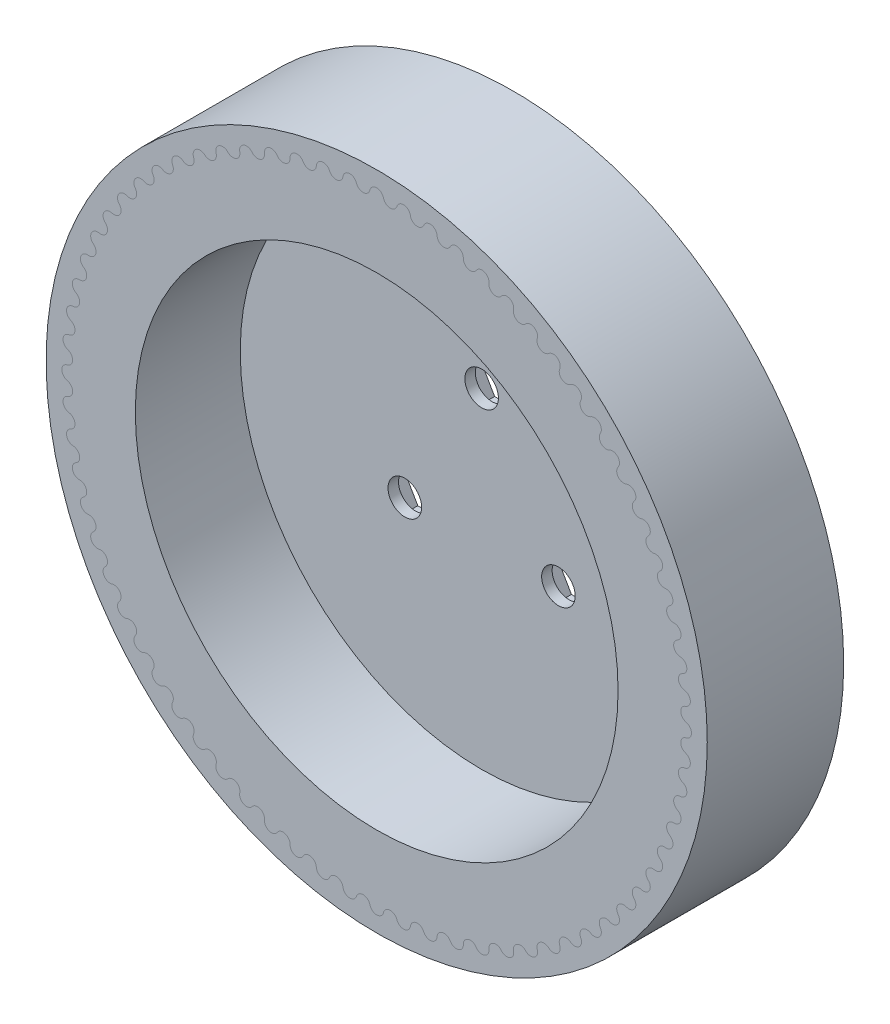
from build123d import *

# Parameters (mm, degrees)
SKETCH1_R           = 23
BOSS_EXTRUDE1_DEPTH = 10
SKETCH2_R           = 31.5
BOSS_EXTRUDE3_DEPTH = 10
SKETCH4_R           = 31.5
BOSS_EXTRUDE4_DEPTH = 3
CUT_EXTRUDE1_DEPTH  = 2
HOLE1_START         = -1
HOLE1_OUTLINE_R     = 1.6
HOLE1_DEPTH         = 1


# Read off the part's stored shape, not the designer's step: Hole1
with BuildPart() as part:
    # Sketch1 → Boss-Extrude1 (new body)
    with BuildSketch(Plane.XY):
        with BuildLine():
            ThreePointArc((1.929392312, 29.436838236), (2.614672282, 29.885840943), (3.211572808, 29.324661978))
            ThreePointArc((3.211572808, 29.324661978), (3.785394016, 28.752922168), (4.487639893, 29.156664559))
            ThreePointArc((4.487639893, 29.156664559), (5.20944533, 29.54423259), (5.755164499, 28.933165772))
            ThreePointArc((5.755164499, 28.933165772), (6.276971737, 28.313589791), (7.011733824, 28.654591059))
            ThreePointArc((7.011733824, 28.654591059), (7.764571353, 28.977774789), (8.254955914, 28.321470704))
            ThreePointArc((8.254955914, 28.321470704), (8.720777913, 27.6587739), (9.482464226, 27.93443882))
            ThreePointArc((9.482464226, 27.93443882), (10.2606043, 28.190778624), (10.691922129, 27.494232144))
            ThreePointArc((10.691922129, 27.494232144), (11.098213703, 26.793458039), (11.881027351, 27.001688634))
            ThreePointArc((11.881027351, 27.001688634), (12.678547852, 27.189233611), (13.047516361, 26.457745875))
            ThreePointArc((13.047516361, 26.457745875), (13.391185385, 25.724227783), (14.189168683, 25.863439293))
            ThreePointArc((14.189168683, 25.863439293), (15, 25.980762114), (15.303811116, 25.219900185))
            ThreePointArc((15.303811116, 25.219900185), (15.582242061, 24.459220622), (16.389321874, 24.528353563))
            ThreePointArc((16.389321874, 24.528353563), (17.207293091, 24.574561329), (17.443634627, 23.790115826))
            ThreePointArc((17.443634627, 23.790115826), (17.654708466, 23.008064022), (18.464742429, 23.006592251))
            ThreePointArc((18.464742429, 23.006592251), (19.283628291, 22.981333294), (19.450701545, 22.179274321))
            ThreePointArc((19.450701545, 22.179274321), (19.592811879, 21.381802163), (20.399635146, 21.309736881))
            ThreePointArc((20.399635146, 21.309736881), (21.213203436, 21.213203436), (21.309736881, 20.399635146))
            ThreePointArc((21.309736881, 20.399635146), (21.381802163, 19.592811879), (22.179274321, 19.450701545))
            ThreePointArc((22.179274321, 19.450701545), (22.981333294, 19.283628291), (23.006592251, 18.464742429))
            ThreePointArc((23.006592251, 18.464742429), (23.008064022, 17.654708466), (23.790115826, 17.443634627))
            ThreePointArc((23.790115826, 17.443634627), (24.574561329, 17.207293091), (24.528353563, 16.389321874))
            ThreePointArc((24.528353563, 16.389321874), (24.459220622, 15.582242061), (25.219900185, 15.303811116))
            ThreePointArc((25.219900185, 15.303811116), (25.980762114, 15), (25.863439293, 14.189168683))
            ThreePointArc((25.863439293, 14.189168683), (25.724227783, 13.391185385), (26.457745875, 13.047516361))
            ThreePointArc((26.457745875, 13.047516361), (27.189233611, 12.678547852), (27.001688634, 11.881027351))
            ThreePointArc((27.001688634, 11.881027351), (26.793458039, 11.098213703), (27.494232144, 10.691922129))
            ThreePointArc((27.494232144, 10.691922129), (28.190778624, 10.2606043), (27.93443882, 9.482464226))
            ThreePointArc((27.93443882, 9.482464226), (27.6587739, 8.720777913), (28.321470704, 8.254955914))
            ThreePointArc((28.321470704, 8.254955914), (28.977774789, 7.764571353), (28.654591059, 7.011733824))
            ThreePointArc((28.654591059, 7.011733824), (28.313589791, 6.276971737), (28.933165772, 5.755164499))
            ThreePointArc((28.933165772, 5.755164499), (29.54423259, 5.20944533), (29.156664559, 4.487639893))
            ThreePointArc((29.156664559, 4.487639893), (28.752922168, 3.785394016), (29.324661978, 3.211572808))
            ThreePointArc((29.324661978, 3.211572808), (29.885840943, 2.614672282), (29.436838236, 1.929392312))
            ThreePointArc((29.436838236, 1.929392312), (28.973427446, 1.265007162), (29.492979799, 0.643539109))
            ThreePointArc((29.492979799, 0.643539109), (30, 0), (29.492979799, -0.643539109))
            ThreePointArc((29.492979799, -0.643539109), (28.973427446, -1.265007162), (29.436838236, -1.929392312))
            ThreePointArc((29.436838236, -1.929392312), (29.885840943, -2.614672282), (29.324661978, -3.211572808))
            ThreePointArc((29.324661978, -3.211572808), (28.752922168, -3.785394016), (29.156664559, -4.487639893))
            ThreePointArc((29.156664559, -4.487639893), (29.54423259, -5.20944533), (28.933165772, -5.755164499))
            ThreePointArc((28.933165772, -5.755164499), (28.313589791, -6.276971737), (28.654591059, -7.011733824))
            ThreePointArc((28.654591059, -7.011733824), (28.977774789, -7.764571353), (28.321470704, -8.254955914))
            ThreePointArc((28.321470704, -8.254955914), (27.6587739, -8.720777913), (27.93443882, -9.482464226))
            ThreePointArc((27.93443882, -9.482464226), (28.190778624, -10.2606043), (27.494232144, -10.691922129))
            ThreePointArc((27.494232144, -10.691922129), (26.793458039, -11.098213703), (27.001688634, -11.881027351))
            ThreePointArc((27.001688634, -11.881027351), (27.189233611, -12.678547852), (26.457745875, -13.047516361))
            ThreePointArc((26.457745875, -13.047516361), (25.724227783, -13.391185385), (25.863439293, -14.189168683))
            ThreePointArc((25.863439293, -14.189168683), (25.980762114, -15), (25.219900185, -15.303811116))
            ThreePointArc((25.219900185, -15.303811116), (24.459220622, -15.582242061), (24.528353563, -16.389321874))
            ThreePointArc((24.528353563, -16.389321874), (24.574561329, -17.207293091), (23.790115826, -17.443634627))
            ThreePointArc((23.790115826, -17.443634627), (23.008064022, -17.654708466), (23.006592251, -18.464742429))
            ThreePointArc((23.006592251, -18.464742429), (22.981333294, -19.283628291), (22.179274321, -19.450701545))
            ThreePointArc((22.179274321, -19.450701545), (21.381802163, -19.592811879), (21.309736881, -20.399635146))
            ThreePointArc((21.309736881, -20.399635146), (21.213203436, -21.213203436), (20.399635146, -21.309736881))
            ThreePointArc((20.399635146, -21.309736881), (19.592811879, -21.381802163), (19.450701545, -22.179274321))
            ThreePointArc((19.450701545, -22.179274321), (19.283628291, -22.981333294), (18.464742429, -23.006592251))
            ThreePointArc((18.464742429, -23.006592251), (17.654708466, -23.008064022), (17.443634627, -23.790115826))
            ThreePointArc((17.443634627, -23.790115826), (17.207293091, -24.574561329), (16.389321874, -24.528353563))
            ThreePointArc((16.389321874, -24.528353563), (15.582242061, -24.459220622), (15.303811116, -25.219900185))
            ThreePointArc((15.303811116, -25.219900185), (15, -25.980762114), (14.189168683, -25.863439293))
            ThreePointArc((14.189168683, -25.863439293), (13.391185385, -25.724227783), (13.047516361, -26.457745875))
            ThreePointArc((13.047516361, -26.457745875), (12.678547852, -27.189233611), (11.881027351, -27.001688634))
            ThreePointArc((11.881027351, -27.001688634), (11.098213703, -26.793458039), (10.691922129, -27.494232144))
            ThreePointArc((10.691922129, -27.494232144), (10.2606043, -28.190778624), (9.482464226, -27.93443882))
            ThreePointArc((9.482464226, -27.93443882), (8.720777913, -27.6587739), (8.254955914, -28.321470704))
            ThreePointArc((8.254955914, -28.321470704), (7.764571353, -28.977774789), (7.011733824, -28.654591059))
            ThreePointArc((7.011733824, -28.654591059), (6.276971737, -28.313589791), (5.755164499, -28.933165772))
            ThreePointArc((5.755164499, -28.933165772), (5.20944533, -29.54423259), (4.487639893, -29.156664559))
            ThreePointArc((4.487639893, -29.156664559), (3.785394016, -28.752922168), (3.211572808, -29.324661978))
            ThreePointArc((3.211572808, -29.324661978), (2.614672282, -29.885840943), (1.929392312, -29.436838236))
            ThreePointArc((1.929392312, -29.436838236), (1.265007162, -28.973427446), (0.643539109, -29.492979799))
            ThreePointArc((0.643539109, -29.492979799), (0, -30), (-0.643539109, -29.492979799))
            ThreePointArc((-0.643539109, -29.492979799), (-1.265007162, -28.973427446), (-1.929392312, -29.436838236))
            ThreePointArc((-1.929392312, -29.436838236), (-2.614672282, -29.885840943), (-3.211572808, -29.324661978))
            ThreePointArc((-3.211572808, -29.324661978), (-3.785394016, -28.752922168), (-4.487639893, -29.156664559))
            ThreePointArc((-4.487639893, -29.156664559), (-5.20944533, -29.54423259), (-5.755164499, -28.933165772))
            ThreePointArc((-5.755164499, -28.933165772), (-6.276971737, -28.313589791), (-7.011733824, -28.654591059))
            ThreePointArc((-7.011733824, -28.654591059), (-7.764571353, -28.977774789), (-8.254955914, -28.321470704))
            ThreePointArc((-8.254955914, -28.321470704), (-8.720777913, -27.6587739), (-9.482464226, -27.93443882))
            ThreePointArc((-9.482464226, -27.93443882), (-10.2606043, -28.190778624), (-10.691922129, -27.494232144))
            ThreePointArc((-10.691922129, -27.494232144), (-11.098213703, -26.793458039), (-11.881027351, -27.001688634))
            ThreePointArc((-11.881027351, -27.001688634), (-12.678547852, -27.189233611), (-13.047516361, -26.457745875))
            ThreePointArc((-13.047516361, -26.457745875), (-13.391185385, -25.724227783), (-14.189168683, -25.863439293))
            ThreePointArc((-14.189168683, -25.863439293), (-15, -25.980762114), (-15.303811116, -25.219900185))
            ThreePointArc((-15.303811116, -25.219900185), (-15.582242061, -24.459220622), (-16.389321874, -24.528353563))
            ThreePointArc((-16.389321874, -24.528353563), (-17.207293091, -24.574561329), (-17.443634627, -23.790115826))
            ThreePointArc((-17.443634627, -23.790115826), (-17.654708466, -23.008064022), (-18.464742429, -23.006592251))
            ThreePointArc((-18.464742429, -23.006592251), (-19.283628291, -22.981333294), (-19.450701545, -22.179274321))
            ThreePointArc((-19.450701545, -22.179274321), (-19.592811879, -21.381802163), (-20.399635146, -21.309736881))
            ThreePointArc((-20.399635146, -21.309736881), (-21.213203436, -21.213203436), (-21.309736881, -20.399635146))
            ThreePointArc((-21.309736881, -20.399635146), (-21.381802163, -19.592811879), (-22.179274321, -19.450701545))
            ThreePointArc((-22.179274321, -19.450701545), (-22.981333294, -19.283628291), (-23.006592251, -18.464742429))
            ThreePointArc((-23.006592251, -18.464742429), (-23.008064022, -17.654708466), (-23.790115826, -17.443634627))
            ThreePointArc((-23.790115826, -17.443634627), (-24.574561329, -17.207293091), (-24.528353563, -16.389321874))
            ThreePointArc((-24.528353563, -16.389321874), (-24.459220622, -15.582242061), (-25.219900185, -15.303811116))
            ThreePointArc((-25.219900185, -15.303811116), (-25.980762114, -15), (-25.863439293, -14.189168683))
            ThreePointArc((-25.863439293, -14.189168683), (-25.724227783, -13.391185385), (-26.457745875, -13.047516361))
            ThreePointArc((-26.457745875, -13.047516361), (-27.189233611, -12.678547852), (-27.001688634, -11.881027351))
            ThreePointArc((-27.001688634, -11.881027351), (-26.793458039, -11.098213703), (-27.494232144, -10.691922129))
            ThreePointArc((-27.494232144, -10.691922129), (-28.190778624, -10.2606043), (-27.93443882, -9.482464226))
            ThreePointArc((-27.93443882, -9.482464226), (-27.6587739, -8.720777913), (-28.321470704, -8.254955914))
            ThreePointArc((-28.321470704, -8.254955914), (-28.977774789, -7.764571353), (-28.654591059, -7.011733824))
            ThreePointArc((-28.654591059, -7.011733824), (-28.313589791, -6.276971737), (-28.933165772, -5.755164499))
            ThreePointArc((-28.933165772, -5.755164499), (-29.54423259, -5.20944533), (-29.156664559, -4.487639893))
            ThreePointArc((-29.156664559, -4.487639893), (-28.752922168, -3.785394016), (-29.324661978, -3.211572808))
            ThreePointArc((-29.324661978, -3.211572808), (-29.885840943, -2.614672282), (-29.436838236, -1.929392312))
            ThreePointArc((-29.436838236, -1.929392312), (-28.973427446, -1.265007162), (-29.492979799, -0.643539109))
            ThreePointArc((-29.492979799, -0.643539109), (-30, 0), (-29.492979799, 0.643539109))
            ThreePointArc((-29.492979799, 0.643539109), (-28.973427446, 1.265007162), (-29.436838236, 1.929392312))
            ThreePointArc((-29.436838236, 1.929392312), (-29.885840943, 2.614672282), (-29.324661978, 3.211572808))
            ThreePointArc((-29.324661978, 3.211572808), (-28.752922168, 3.785394016), (-29.156664559, 4.487639893))
            ThreePointArc((-29.156664559, 4.487639893), (-29.54423259, 5.20944533), (-28.933165772, 5.755164499))
            ThreePointArc((-28.933165772, 5.755164499), (-28.313589791, 6.276971737), (-28.654591059, 7.011733824))
            ThreePointArc((-28.654591059, 7.011733824), (-28.977774789, 7.764571353), (-28.321470704, 8.254955914))
            ThreePointArc((-28.321470704, 8.254955914), (-27.6587739, 8.720777913), (-27.93443882, 9.482464226))
            ThreePointArc((-27.93443882, 9.482464226), (-28.190778624, 10.2606043), (-27.494232144, 10.691922129))
            ThreePointArc((-27.494232144, 10.691922129), (-26.793458039, 11.098213703), (-27.001688634, 11.881027351))
            ThreePointArc((-27.001688634, 11.881027351), (-27.189233611, 12.678547852), (-26.457745875, 13.047516361))
            ThreePointArc((-26.457745875, 13.047516361), (-25.724227783, 13.391185385), (-25.863439293, 14.189168683))
            ThreePointArc((-25.863439293, 14.189168683), (-25.980762114, 15), (-25.219900185, 15.303811116))
            ThreePointArc((-25.219900185, 15.303811116), (-24.459220622, 15.582242061), (-24.528353563, 16.389321874))
            ThreePointArc((-24.528353563, 16.389321874), (-24.574561329, 17.207293091), (-23.790115826, 17.443634627))
            ThreePointArc((-23.790115826, 17.443634627), (-23.008064022, 17.654708466), (-23.006592251, 18.464742429))
            ThreePointArc((-23.006592251, 18.464742429), (-22.981333294, 19.283628291), (-22.179274321, 19.450701545))
            ThreePointArc((-22.179274321, 19.450701545), (-21.381802163, 19.592811879), (-21.309736881, 20.399635146))
            ThreePointArc((-21.309736881, 20.399635146), (-21.213203436, 21.213203436), (-20.399635146, 21.309736881))
            ThreePointArc((-20.399635146, 21.309736881), (-19.592811879, 21.381802163), (-19.450701545, 22.179274321))
            ThreePointArc((-19.450701545, 22.179274321), (-19.283628291, 22.981333294), (-18.464742429, 23.006592251))
            ThreePointArc((-18.464742429, 23.006592251), (-17.654708466, 23.008064022), (-17.443634627, 23.790115826))
            ThreePointArc((-17.443634627, 23.790115826), (-17.207293091, 24.574561329), (-16.389321874, 24.528353563))
            ThreePointArc((-16.389321874, 24.528353563), (-15.582242061, 24.459220622), (-15.303811116, 25.219900185))
            ThreePointArc((-15.303811116, 25.219900185), (-15, 25.980762114), (-14.189168683, 25.863439293))
            ThreePointArc((-14.189168683, 25.863439293), (-13.391185385, 25.724227783), (-13.047516361, 26.457745875))
            ThreePointArc((-13.047516361, 26.457745875), (-12.678547852, 27.189233611), (-11.881027351, 27.001688634))
            ThreePointArc((-11.881027351, 27.001688634), (-11.098213703, 26.793458039), (-10.691922129, 27.494232144))
            ThreePointArc((-10.691922129, 27.494232144), (-10.2606043, 28.190778624), (-9.482464226, 27.93443882))
            ThreePointArc((-9.482464226, 27.93443882), (-8.720777913, 27.6587739), (-8.254955914, 28.321470704))
            ThreePointArc((-8.254955914, 28.321470704), (-7.764571353, 28.977774789), (-7.011733824, 28.654591059))
            ThreePointArc((-7.011733824, 28.654591059), (-6.276971737, 28.313589791), (-5.755164499, 28.933165772))
            ThreePointArc((-5.755164499, 28.933165772), (-5.20944533, 29.54423259), (-4.487639893, 29.156664559))
            ThreePointArc((-4.487639893, 29.156664559), (-3.785394016, 28.752922168), (-3.211572808, 29.324661978))
            ThreePointArc((-3.211572808, 29.324661978), (-2.614672282, 29.885840943), (-1.929392312, 29.436838236))
            ThreePointArc((-1.929392312, 29.436838236), (-1.265007162, 28.973427446), (-0.643539109, 29.492979799))
            ThreePointArc((-0.643539109, 29.492979799), (0, 30), (0.643539109, 29.492979799))
            ThreePointArc((0.643539109, 29.492979799), (1.265007162, 28.973427446), (1.929392312, 29.436838236))
        make_face()
        Circle(SKETCH1_R, mode=Mode.SUBTRACT)
    extrude(amount=BOSS_EXTRUDE1_DEPTH)


with BuildPart() as body_2:
    # Sketch2 → Boss-Extrude3 (new body)
    with BuildSketch(Plane.XY.offset(10)):
        Circle(SKETCH2_R)
        with BuildLine():
            ThreePointArc((0.643539109, 29.492979799), (0, 30), (-0.643539109, 29.492979799))
            ThreePointArc((-0.643539109, 29.492979799), (-1.265007162, 28.973427446), (-1.929392312, 29.436838236))
            ThreePointArc((-1.929392312, 29.436838236), (-2.614672282, 29.885840943), (-3.211572808, 29.324661978))
            ThreePointArc((-3.211572808, 29.324661978), (-3.785394016, 28.752922168), (-4.487639893, 29.156664559))
            ThreePointArc((-4.487639893, 29.156664559), (-5.20944533, 29.54423259), (-5.755164499, 28.933165772))
            ThreePointArc((-5.755164499, 28.933165772), (-6.276971737, 28.313589791), (-7.011733824, 28.654591059))
            ThreePointArc((-7.011733824, 28.654591059), (-7.764571353, 28.977774789), (-8.254955914, 28.321470704))
            ThreePointArc((-8.254955914, 28.321470704), (-8.720777913, 27.6587739), (-9.482464226, 27.93443882))
            ThreePointArc((-9.482464226, 27.93443882), (-10.2606043, 28.190778624), (-10.691922129, 27.494232144))
            ThreePointArc((-10.691922129, 27.494232144), (-11.098213703, 26.793458039), (-11.881027351, 27.001688634))
            ThreePointArc((-11.881027351, 27.001688634), (-12.678547852, 27.189233611), (-13.047516361, 26.457745875))
            ThreePointArc((-13.047516361, 26.457745875), (-13.391185385, 25.724227783), (-14.189168683, 25.863439293))
            ThreePointArc((-14.189168683, 25.863439293), (-15, 25.980762114), (-15.303811116, 25.219900185))
            ThreePointArc((-15.303811116, 25.219900185), (-15.582242061, 24.459220622), (-16.389321874, 24.528353563))
            ThreePointArc((-16.389321874, 24.528353563), (-17.207293091, 24.574561329), (-17.443634627, 23.790115826))
            ThreePointArc((-17.443634627, 23.790115826), (-17.654708466, 23.008064022), (-18.464742429, 23.006592251))
            ThreePointArc((-18.464742429, 23.006592251), (-19.283628291, 22.981333294), (-19.450701545, 22.179274321))
            ThreePointArc((-19.450701545, 22.179274321), (-19.592811879, 21.381802163), (-20.399635146, 21.309736881))
            ThreePointArc((-20.399635146, 21.309736881), (-21.213203436, 21.213203436), (-21.309736881, 20.399635146))
            ThreePointArc((-21.309736881, 20.399635146), (-21.381802163, 19.592811879), (-22.179274321, 19.450701545))
            ThreePointArc((-22.179274321, 19.450701545), (-22.981333294, 19.283628291), (-23.006592251, 18.464742429))
            ThreePointArc((-23.006592251, 18.464742429), (-23.008064022, 17.654708466), (-23.790115826, 17.443634627))
            ThreePointArc((-23.790115826, 17.443634627), (-24.574561329, 17.207293091), (-24.528353563, 16.389321874))
            ThreePointArc((-24.528353563, 16.389321874), (-24.459220622, 15.582242061), (-25.219900185, 15.303811116))
            ThreePointArc((-25.219900185, 15.303811116), (-25.980762114, 15), (-25.863439293, 14.189168683))
            ThreePointArc((-25.863439293, 14.189168683), (-25.724227783, 13.391185385), (-26.457745875, 13.047516361))
            ThreePointArc((-26.457745875, 13.047516361), (-27.189233611, 12.678547852), (-27.001688634, 11.881027351))
            ThreePointArc((-27.001688634, 11.881027351), (-26.793458039, 11.098213703), (-27.494232144, 10.691922129))
            ThreePointArc((-27.494232144, 10.691922129), (-28.190778624, 10.2606043), (-27.93443882, 9.482464226))
            ThreePointArc((-27.93443882, 9.482464226), (-27.6587739, 8.720777913), (-28.321470704, 8.254955914))
            ThreePointArc((-28.321470704, 8.254955914), (-28.977774789, 7.764571353), (-28.654591059, 7.011733824))
            ThreePointArc((-28.654591059, 7.011733824), (-28.313589791, 6.276971737), (-28.933165772, 5.755164499))
            ThreePointArc((-28.933165772, 5.755164499), (-29.54423259, 5.20944533), (-29.156664559, 4.487639893))
            ThreePointArc((-29.156664559, 4.487639893), (-28.752922168, 3.785394016), (-29.324661978, 3.211572808))
            ThreePointArc((-29.324661978, 3.211572808), (-29.885840943, 2.614672282), (-29.436838236, 1.929392312))
            ThreePointArc((-29.436838236, 1.929392312), (-28.973427446, 1.265007162), (-29.492979799, 0.643539109))
            ThreePointArc((-29.492979799, 0.643539109), (-30, 0), (-29.492979799, -0.643539109))
            ThreePointArc((-29.492979799, -0.643539109), (-28.973427446, -1.265007162), (-29.436838236, -1.929392312))
            ThreePointArc((-29.436838236, -1.929392312), (-29.885840943, -2.614672282), (-29.324661978, -3.211572808))
            ThreePointArc((-29.324661978, -3.211572808), (-28.752922168, -3.785394016), (-29.156664559, -4.487639893))
            ThreePointArc((-29.156664559, -4.487639893), (-29.54423259, -5.20944533), (-28.933165772, -5.755164499))
            ThreePointArc((-28.933165772, -5.755164499), (-28.313589791, -6.276971737), (-28.654591059, -7.011733824))
            ThreePointArc((-28.654591059, -7.011733824), (-28.977774789, -7.764571353), (-28.321470704, -8.254955914))
            ThreePointArc((-28.321470704, -8.254955914), (-27.6587739, -8.720777913), (-27.93443882, -9.482464226))
            ThreePointArc((-27.93443882, -9.482464226), (-28.190778624, -10.2606043), (-27.494232144, -10.691922129))
            ThreePointArc((-27.494232144, -10.691922129), (-26.793458039, -11.098213703), (-27.001688634, -11.881027351))
            ThreePointArc((-27.001688634, -11.881027351), (-27.189233611, -12.678547852), (-26.457745875, -13.047516361))
            ThreePointArc((-26.457745875, -13.047516361), (-25.724227783, -13.391185385), (-25.863439293, -14.189168683))
            ThreePointArc((-25.863439293, -14.189168683), (-25.980762114, -15), (-25.219900185, -15.303811116))
            ThreePointArc((-25.219900185, -15.303811116), (-24.459220622, -15.582242061), (-24.528353563, -16.389321874))
            ThreePointArc((-24.528353563, -16.389321874), (-24.574561329, -17.207293091), (-23.790115826, -17.443634627))
            ThreePointArc((-23.790115826, -17.443634627), (-23.008064022, -17.654708466), (-23.006592251, -18.464742429))
            ThreePointArc((-23.006592251, -18.464742429), (-22.981333294, -19.283628291), (-22.179274321, -19.450701545))
            ThreePointArc((-22.179274321, -19.450701545), (-21.381802163, -19.592811879), (-21.309736881, -20.399635146))
            ThreePointArc((-21.309736881, -20.399635146), (-21.213203436, -21.213203436), (-20.399635146, -21.309736881))
            ThreePointArc((-20.399635146, -21.309736881), (-19.592811879, -21.381802163), (-19.450701545, -22.179274321))
            ThreePointArc((-19.450701545, -22.179274321), (-19.283628291, -22.981333294), (-18.464742429, -23.006592251))
            ThreePointArc((-18.464742429, -23.006592251), (-17.654708466, -23.008064022), (-17.443634627, -23.790115826))
            ThreePointArc((-17.443634627, -23.790115826), (-17.207293091, -24.574561329), (-16.389321874, -24.528353563))
            ThreePointArc((-16.389321874, -24.528353563), (-15.582242061, -24.459220622), (-15.303811116, -25.219900185))
            ThreePointArc((-15.303811116, -25.219900185), (-15, -25.980762114), (-14.189168683, -25.863439293))
            ThreePointArc((-14.189168683, -25.863439293), (-13.391185385, -25.724227783), (-13.047516361, -26.457745875))
            ThreePointArc((-13.047516361, -26.457745875), (-12.678547852, -27.189233611), (-11.881027351, -27.001688634))
            ThreePointArc((-11.881027351, -27.001688634), (-11.098213703, -26.793458039), (-10.691922129, -27.494232144))
            ThreePointArc((-10.691922129, -27.494232144), (-10.2606043, -28.190778624), (-9.482464226, -27.93443882))
            ThreePointArc((-9.482464226, -27.93443882), (-8.720777913, -27.6587739), (-8.254955914, -28.321470704))
            ThreePointArc((-8.254955914, -28.321470704), (-7.764571353, -28.977774789), (-7.011733824, -28.654591059))
            ThreePointArc((-7.011733824, -28.654591059), (-6.276971737, -28.313589791), (-5.755164499, -28.933165772))
            ThreePointArc((-5.755164499, -28.933165772), (-5.20944533, -29.54423259), (-4.487639893, -29.156664559))
            ThreePointArc((-4.487639893, -29.156664559), (-3.785394016, -28.752922168), (-3.211572808, -29.324661978))
            ThreePointArc((-3.211572808, -29.324661978), (-2.614672282, -29.885840943), (-1.929392312, -29.436838236))
            ThreePointArc((-1.929392312, -29.436838236), (-1.265007162, -28.973427446), (-0.643539109, -29.492979799))
            ThreePointArc((-0.643539109, -29.492979799), (0, -30), (0.643539109, -29.492979799))
            ThreePointArc((0.643539109, -29.492979799), (1.265007162, -28.973427446), (1.929392312, -29.436838236))
            ThreePointArc((1.929392312, -29.436838236), (2.614672282, -29.885840943), (3.211572808, -29.324661978))
            ThreePointArc((3.211572808, -29.324661978), (3.785394016, -28.752922168), (4.487639893, -29.156664559))
            ThreePointArc((4.487639893, -29.156664559), (5.20944533, -29.54423259), (5.755164499, -28.933165772))
            ThreePointArc((5.755164499, -28.933165772), (6.276971737, -28.313589791), (7.011733824, -28.654591059))
            ThreePointArc((7.011733824, -28.654591059), (7.764571353, -28.977774789), (8.254955914, -28.321470704))
            ThreePointArc((8.254955914, -28.321470704), (8.720777913, -27.6587739), (9.482464226, -27.93443882))
            ThreePointArc((9.482464226, -27.93443882), (10.2606043, -28.190778624), (10.691922129, -27.494232144))
            ThreePointArc((10.691922129, -27.494232144), (11.098213703, -26.793458039), (11.881027351, -27.001688634))
            ThreePointArc((11.881027351, -27.001688634), (12.678547852, -27.189233611), (13.047516361, -26.457745875))
            ThreePointArc((13.047516361, -26.457745875), (13.391185385, -25.724227783), (14.189168683, -25.863439293))
            ThreePointArc((14.189168683, -25.863439293), (15, -25.980762114), (15.303811116, -25.219900185))
            ThreePointArc((15.303811116, -25.219900185), (15.582242061, -24.459220622), (16.389321874, -24.528353563))
            ThreePointArc((16.389321874, -24.528353563), (17.207293091, -24.574561329), (17.443634627, -23.790115826))
            ThreePointArc((17.443634627, -23.790115826), (17.654708466, -23.008064022), (18.464742429, -23.006592251))
            ThreePointArc((18.464742429, -23.006592251), (19.283628291, -22.981333294), (19.450701545, -22.179274321))
            ThreePointArc((19.450701545, -22.179274321), (19.592811879, -21.381802163), (20.399635146, -21.309736881))
            ThreePointArc((20.399635146, -21.309736881), (21.213203436, -21.213203436), (21.309736881, -20.399635146))
            ThreePointArc((21.309736881, -20.399635146), (21.381802163, -19.592811879), (22.179274321, -19.450701545))
            ThreePointArc((22.179274321, -19.450701545), (22.981333294, -19.283628291), (23.006592251, -18.464742429))
            ThreePointArc((23.006592251, -18.464742429), (23.008064022, -17.654708466), (23.790115826, -17.443634627))
            ThreePointArc((23.790115826, -17.443634627), (24.574561329, -17.207293091), (24.528353563, -16.389321874))
            ThreePointArc((24.528353563, -16.389321874), (24.459220622, -15.582242061), (25.219900185, -15.303811116))
            ThreePointArc((25.219900185, -15.303811116), (25.980762114, -15), (25.863439293, -14.189168683))
            ThreePointArc((25.863439293, -14.189168683), (25.724227783, -13.391185385), (26.457745875, -13.047516361))
            ThreePointArc((26.457745875, -13.047516361), (27.189233611, -12.678547852), (27.001688634, -11.881027351))
            ThreePointArc((27.001688634, -11.881027351), (26.793458039, -11.098213703), (27.494232144, -10.691922129))
            ThreePointArc((27.494232144, -10.691922129), (28.190778624, -10.2606043), (27.93443882, -9.482464226))
            ThreePointArc((27.93443882, -9.482464226), (27.6587739, -8.720777913), (28.321470704, -8.254955914))
            ThreePointArc((28.321470704, -8.254955914), (28.977774789, -7.764571353), (28.654591059, -7.011733824))
            ThreePointArc((28.654591059, -7.011733824), (28.313589791, -6.276971737), (28.933165772, -5.755164499))
            ThreePointArc((28.933165772, -5.755164499), (29.54423259, -5.20944533), (29.156664559, -4.487639893))
            ThreePointArc((29.156664559, -4.487639893), (28.752922168, -3.785394016), (29.324661978, -3.211572808))
            ThreePointArc((29.324661978, -3.211572808), (29.885840943, -2.614672282), (29.436838236, -1.929392312))
            ThreePointArc((29.436838236, -1.929392312), (28.973427446, -1.265007162), (29.492979799, -0.643539109))
            ThreePointArc((29.492979799, -0.643539109), (30, 0), (29.492979799, 0.643539109))
            ThreePointArc((29.492979799, 0.643539109), (28.973427446, 1.265007162), (29.436838236, 1.929392312))
            ThreePointArc((29.436838236, 1.929392312), (29.885840943, 2.614672282), (29.324661978, 3.211572808))
            ThreePointArc((29.324661978, 3.211572808), (28.752922168, 3.785394016), (29.156664559, 4.487639893))
            ThreePointArc((29.156664559, 4.487639893), (29.54423259, 5.20944533), (28.933165772, 5.755164499))
            ThreePointArc((28.933165772, 5.755164499), (28.313589791, 6.276971737), (28.654591059, 7.011733824))
            ThreePointArc((28.654591059, 7.011733824), (28.977774789, 7.764571353), (28.321470704, 8.254955914))
            ThreePointArc((28.321470704, 8.254955914), (27.6587739, 8.720777913), (27.93443882, 9.482464226))
            ThreePointArc((27.93443882, 9.482464226), (28.190778624, 10.2606043), (27.494232144, 10.691922129))
            ThreePointArc((27.494232144, 10.691922129), (26.793458039, 11.098213703), (27.001688634, 11.881027351))
            ThreePointArc((27.001688634, 11.881027351), (27.189233611, 12.678547852), (26.457745875, 13.047516361))
            ThreePointArc((26.457745875, 13.047516361), (25.724227783, 13.391185385), (25.863439293, 14.189168683))
            ThreePointArc((25.863439293, 14.189168683), (25.980762114, 15), (25.219900185, 15.303811116))
            ThreePointArc((25.219900185, 15.303811116), (24.459220622, 15.582242061), (24.528353563, 16.389321874))
            ThreePointArc((24.528353563, 16.389321874), (24.574561329, 17.207293091), (23.790115826, 17.443634627))
            ThreePointArc((23.790115826, 17.443634627), (23.008064022, 17.654708466), (23.006592251, 18.464742429))
            ThreePointArc((23.006592251, 18.464742429), (22.981333294, 19.283628291), (22.179274321, 19.450701545))
            ThreePointArc((22.179274321, 19.450701545), (21.381802163, 19.592811879), (21.309736881, 20.399635146))
            ThreePointArc((21.309736881, 20.399635146), (21.213203436, 21.213203436), (20.399635146, 21.309736881))
            ThreePointArc((20.399635146, 21.309736881), (19.592811879, 21.381802163), (19.450701545, 22.179274321))
            ThreePointArc((19.450701545, 22.179274321), (19.283628291, 22.981333294), (18.464742429, 23.006592251))
            ThreePointArc((18.464742429, 23.006592251), (17.654708466, 23.008064022), (17.443634627, 23.790115826))
            ThreePointArc((17.443634627, 23.790115826), (17.207293091, 24.574561329), (16.389321874, 24.528353563))
            ThreePointArc((16.389321874, 24.528353563), (15.582242061, 24.459220622), (15.303811116, 25.219900185))
            ThreePointArc((15.303811116, 25.219900185), (15, 25.980762114), (14.189168683, 25.863439293))
            ThreePointArc((14.189168683, 25.863439293), (13.391185385, 25.724227783), (13.047516361, 26.457745875))
            ThreePointArc((13.047516361, 26.457745875), (12.678547852, 27.189233611), (11.881027351, 27.001688634))
            ThreePointArc((11.881027351, 27.001688634), (11.098213703, 26.793458039), (10.691922129, 27.494232144))
            ThreePointArc((10.691922129, 27.494232144), (10.2606043, 28.190778624), (9.482464226, 27.93443882))
            ThreePointArc((9.482464226, 27.93443882), (8.720777913, 27.6587739), (8.254955914, 28.321470704))
            ThreePointArc((8.254955914, 28.321470704), (7.764571353, 28.977774789), (7.011733824, 28.654591059))
            ThreePointArc((7.011733824, 28.654591059), (6.276971737, 28.313589791), (5.755164499, 28.933165772))
            ThreePointArc((5.755164499, 28.933165772), (5.20944533, 29.54423259), (4.487639893, 29.156664559))
            ThreePointArc((4.487639893, 29.156664559), (3.785394016, 28.752922168), (3.211572808, 29.324661978))
            ThreePointArc((3.211572808, 29.324661978), (2.614672282, 29.885840943), (1.929392312, 29.436838236))
            ThreePointArc((1.929392312, 29.436838236), (1.265007162, 28.973427446), (0.643539109, 29.492979799))
        make_face(mode=Mode.SUBTRACT)
    extrude(amount=-BOSS_EXTRUDE3_DEPTH)


with BuildPart() as body_3:
    # Sketch4 → Boss-Extrude4 (new body)
    with BuildSketch(Plane(origin=(0, 0, 0), x_dir=(-1, 0, 0), z_dir=(0, 0, -1))):
        Circle(SKETCH4_R)
    extrude(amount=BOSS_EXTRUDE4_DEPTH)

    # Sketch6 → Cut-Extrude1 (cut)
    with BuildSketch(Plane.XY.offset(-3)):
        Polygon((9.078832983, -1.175), (5.556996341, -1.175), (3.79607802, -4.225), (5.556996341, -7.275), (9.078832983, -7.275), (10.839751304, -4.225), align=None)
        Polygon((-3.521836642, 8.45), (-1.760918321, 5.4), (1.760918321, 5.4), (3.521836642, 8.45), (1.760918321, 11.5), (-1.760918321, 11.5), align=None)
        Polygon((-5.556996341, -7.275), (-3.79607802, -4.225), (-5.556996341, -1.175), (-9.078832983, -1.175), (-10.839751304, -4.225), (-9.078832983, -7.275), align=None)
    extrude(amount=CUT_EXTRUDE1_DEPTH, mode=Mode.SUBTRACT)

    # Hole1 outline → Hole1 (cut)
    with BuildSketch(Plane.XY.offset(HOLE1_START)):
        with Locations((7.317914662, -4.225)):
            Circle(HOLE1_OUTLINE_R)
        with Locations((-7.317914662, -4.225)):
            Circle(HOLE1_OUTLINE_R)
        with Locations((0, 8.45)):
            Circle(HOLE1_OUTLINE_R)
    extrude(amount=HOLE1_DEPTH, mode=Mode.SUBTRACT)


with BuildPart() as body_2_1:
    add(body_2.part)

    # Combine1: union body 3
    add(body_3.part)


solid = Compound([part.part, body_2_1.part])
